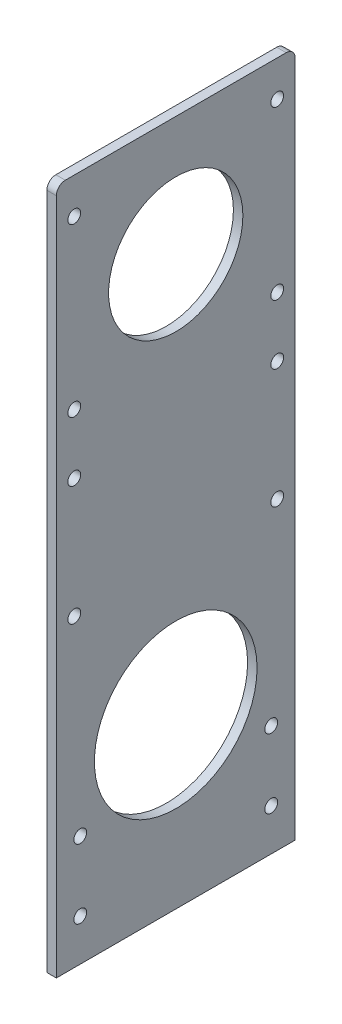
from build123d import *

# Parameters (mm, degrees)
SKETCH1_W           = 80
SKETCH1_H           = 230
SKETCH1_R           = 27.25
SKETCH1_R_2         = 2.15
SKETCH1_R_3         = 22.5
BOSS_EXTRUDE1_DEPTH = 3.175
FILLET1_R           = 3


with BuildPart() as part:
    # Sketch1 → Boss-Extrude1 (new body)
    with BuildSketch(Plane(origin=(0, 0, 0), x_dir=(0, 0, -1), z_dir=(1, 0, 0))):
        Rectangle(SKETCH1_W, SKETCH1_H)
        with Locations((0, -58.65)):
            Circle(SKETCH1_R, mode=Mode.SUBTRACT)
        with Locations((-34, 103)):
            Circle(SKETCH1_R_2, mode=Mode.SUBTRACT)
        with Locations((-34, 47)):
            Circle(SKETCH1_R_2, mode=Mode.SUBTRACT)
        with Locations((34, 47)):
            Circle(SKETCH1_R_2, mode=Mode.SUBTRACT)
        with Locations((34, 103)):
            Circle(SKETCH1_R_2, mode=Mode.SUBTRACT)
        with Locations((0, 75)):
            Circle(SKETCH1_R_3, mode=Mode.SUBTRACT)
        with Locations((-32, -101.025)):
            Circle(SKETCH1_R_2, mode=Mode.SUBTRACT)
        with Locations((32, -101.025)):
            Circle(SKETCH1_R_2, mode=Mode.SUBTRACT)
        with Locations((-32, -77.825)):
            Circle(SKETCH1_R_2, mode=Mode.SUBTRACT)
        with Locations((32, -77.825)):
            Circle(SKETCH1_R_2, mode=Mode.SUBTRACT)
        with Locations((-34, 27)):
            Circle(SKETCH1_R_2, mode=Mode.SUBTRACT)
        with Locations((-34, -13)):
            Circle(SKETCH1_R_2, mode=Mode.SUBTRACT)
        with Locations((34, -13)):
            Circle(SKETCH1_R_2, mode=Mode.SUBTRACT)
        with Locations((34, 27)):
            Circle(SKETCH1_R_2, mode=Mode.SUBTRACT)
    extrude(amount=BOSS_EXTRUDE1_DEPTH)

    # Fillet1
    fillet1_edges = [part.edges().sort_by_distance(p)[0] for p in [
        (1.5875, 115, -40),
        (1.5875, 115, 40),
    ]]
    fillet(fillet1_edges, radius=FILLET1_R)


solid = part.part
